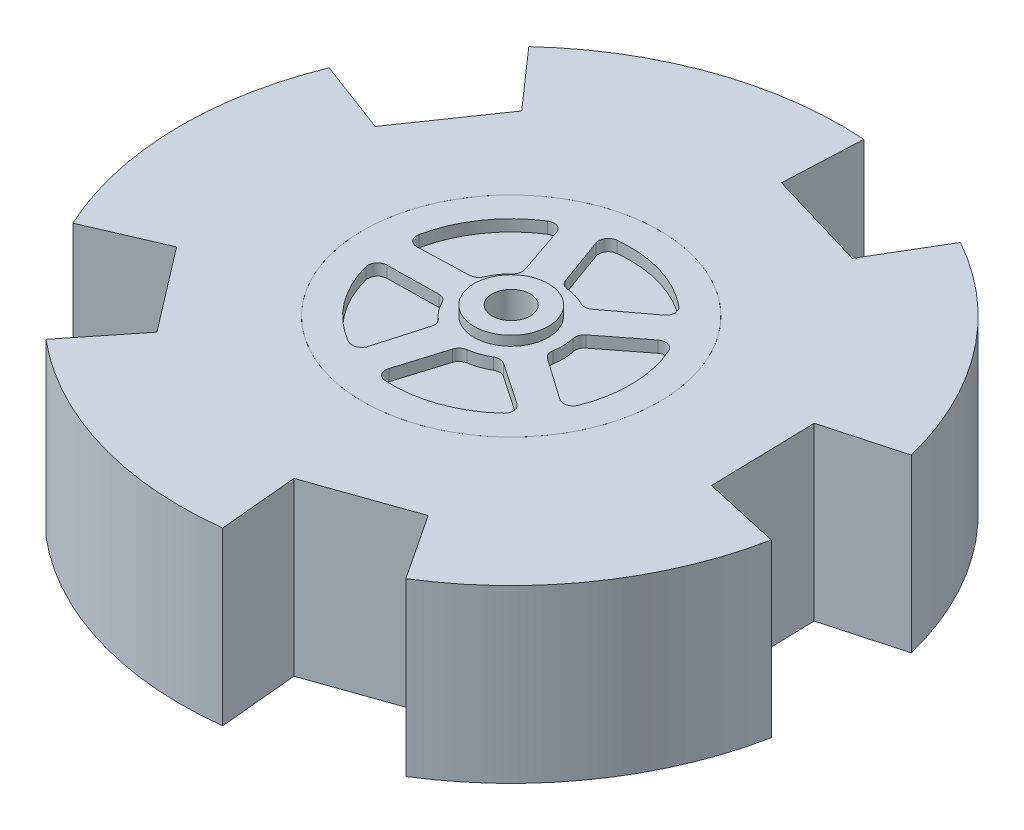
from build123d import *

# Parameters (mm, degrees)
SKETCH1_R                = 34.5
SKETCH1_R_2              = 15.5
BOSS_EXTRUDE1_DEPTH      = 8.95
BOSS_EXTRUDE2_START      = -8.95
SKETCH2_R                = 15.5
BOSS_EXTRUDE2_DEPTH      = 17.9
SKETCH3_R                = 3.875
BOSS_EXTRUDE3_DEPTH      = 1
CUT_EXTRUDE1_START       = 7.75
CUT_EXTRUDE1_DEPTH       = 1.2
FILLET1_R                = 1
CIRPATTERN1_COUNT        = 5
FILLET1_OF_CIRPATTERN1_R = 1
MIRROR1_START            = -8.95
MIRROR1_DEPTH            = 1.2
MIRROR1_START_2          = -9.95
MIRROR1_2_OUTLINE_R      = 3.875
MIRROR1_2_DEPTH          = 1
SKETCH5_R                = 2
CUT_EXTRUDE2_DEPTH       = 53.692599101
CUT_EXTRUDE3_DEPTH       = 53.32313064
CIRPATTERN2_COUNT        = 5


# Read off the part's stored shape, not the designer's step: Cut-Extrude1, Mirror1
with BuildPart() as part:
    # Sketch1 → Boss-Extrude1 (new, symmetric)
    with BuildSketch(Plane(origin=(0, 0, 0), x_dir=(1, 0, 0), z_dir=(0, 1, 0))):
        with Locations(Location((0, 0, 0), (0, 0, 90))):
            Circle(SKETCH1_R)
        with Locations(Location((0, 0, 0), (0, 0, 90))):
            Circle(SKETCH1_R_2, mode=Mode.SUBTRACT)
    extrude(amount=BOSS_EXTRUDE1_DEPTH, both=True)

    # Sketch6 → Cut-Extrude3 (cut, symmetric)
    with BuildSketch(Plane(origin=(0, 8.95, 0), x_dir=(1, 0, 0), z_dir=(0, 1, 0))):
        with BuildLine():
            Line((2.433112603, 34.414095412), (2.064250813, 26.176138082))
            Line((2.064250813, 26.176138082), (12.605799132, 23.03356604))
            Line((12.605799132, 23.03356604), (16.80795122, 30.128769901))
            ThreePointArc((16.80795122, 30.128769901), (9.856248675, 33.062128819), (2.433112603, 34.414095412))
        make_face()
    cut_extrude3 = extrude(amount=CUT_EXTRUDE3_DEPTH, both=True, mode=Mode.SUBTRACT)

    # CirPattern2: Cut-Extrude3 ×5 about axis
    cirpattern2_axis = Axis((0, 0, 0), (0, 1, 0))
    for i in range(1, CIRPATTERN2_COUNT):
        add(cut_extrude3.rotate(cirpattern2_axis, i * 360 / CIRPATTERN2_COUNT), mode=Mode.SUBTRACT)


with BuildPart() as body_2:
    # Sketch2 → Boss-Extrude2 (new body)
    with BuildSketch(Plane(origin=(0, 0, 0), x_dir=(1, 0, 0), z_dir=(0, 1, 0)).offset(BOSS_EXTRUDE2_START)):
        with Locations(Location((0, 0, 0), (0, 0, 270))):
            Circle(SKETCH2_R)
    extrude(amount=BOSS_EXTRUDE2_DEPTH)

    # Sketch3 → Boss-Extrude3 (add)
    with BuildSketch(Plane(origin=(0, 8.95, 0), x_dir=(1, 0, 0), z_dir=(0, 1, 0))):
        with Locations(Location((0, 0, 0), (0, 0, 270))):
            Circle(SKETCH3_R)
    extrude(amount=BOSS_EXTRUDE3_DEPTH)

    # Cut-Extrude1 outline → Cut-Extrude1 (cut)
    with BuildSketch(Plane(origin=(0, 0, 0), x_dir=(1, 0, 0), z_dir=(0, 1, 0)).offset(CUT_EXTRUDE1_START)):
        with BuildLine():
            Line((3.071974537, 4.44105533), (8.842521572, 8.773704599))
            ThreePointArc((8.842521572, 8.773704599), (3.558719439, 11.93748701), (-2.59494852, 12.183362521))
            Line((-2.59494852, 12.183362521), (-0.138760092, 5.398216894))
            ThreePointArc((-0.138760092, 5.398216894), (1.542717184, 5.174941902), (3.071974537, 4.44105533))
        make_face()
    cut_extrude1 = extrude(amount=CUT_EXTRUDE1_DEPTH, mode=Mode.SUBTRACT)

    # Fillet1
    fillet1_edges = [body_2.edges().sort_by_distance(p)[0] for p in [
        (-2.59494852, 8.35, -12.183362521),
        (8.842521572, 8.35, -8.773704599),
        (3.071974537, 8.35, -4.44105533),
        (-0.138760092, 8.35, -5.398216894),
    ]]
    fillet(fillet1_edges, radius=FILLET1_R)

    # CirPattern1: Cut-Extrude1 ×5 about axis
    cirpattern1_axis = Axis((0, 0, 0), (0, 1, 0))
    for i in range(1, CIRPATTERN1_COUNT):
        add(cut_extrude1.rotate(cirpattern1_axis, i * 360 / CIRPATTERN1_COUNT), mode=Mode.SUBTRACT)

    # Fillet1 of CirPattern1
    fillet1_of_cirpattern1_edges = [body_2.edges().sort_by_distance(p)[0] for p in [
        (-12.388949508, 8.35, -1.296923368),
        (-5.611799492, 8.35, -11.120961586),
        (-3.274402273, 8.35, -4.293982971),
        (-5.17688858, 8.35, -1.53617207),
        (-5.061843361, 8.35, 11.381819799),
        (-12.310804396, 8.35, 1.900572351),
        (-5.095666434, 8.35, 1.787227907),
        (-3.060733006, 8.35, 4.448810342),
        (9.260558265, 8.35, 8.331274858),
        (-1.996696054, 8.35, 12.295579897),
        (0.125107221, 8.35, 5.398550563),
        (3.285251552, 8.35, 4.285688071),
        (10.785183124, 8.35, -6.232808767),
        (11.07677837, 8.35, 5.698513937),
        (5.172986949, 8.35, 1.549259831),
        (5.091130127, 8.35, -1.800109449),
    ]]
    fillet(fillet1_of_cirpattern1_edges, radius=FILLET1_OF_CIRPATTERN1_R)

    # Mirror1 outline → Mirror1 (cut)
    with BuildSketch(Plane(origin=(0, 0, 0), x_dir=(1, 0, 0), z_dir=(0, 1, 0)).offset(MIRROR1_START)):
        with BuildLine():
            ThreePointArc((7.912150219, 9.621120468), (3.558719439, 11.93748701), (-1.352433209, 12.383012742))
            ThreePointArc((-1.352433209, 12.383012742), (-2.092524389, 11.917859003), (-2.184150137, 11.048544516))
            Line((-2.184150137, 11.048544516), (-0.368934217, 6.034065893))
            ThreePointArc((-0.368934217, 6.034065893), (-0.03894228, 5.582272129), (0.482079862, 5.378438343))
            ThreePointArc((0.482079862, 5.378438343), (1.542717184, 5.174941902), (2.541647812, 4.764454471))
            ThreePointArc((2.541647812, 4.764454471), (3.089232431, 4.649722745), (3.612743558, 4.847076195))
            Line((3.612743558, 4.847076195), (7.87739554, 8.049067477))
            ThreePointArc((7.87739554, 8.049067477), (8.276731026, 8.826649707), (7.912150219, 9.621120468))
        make_face()
        with BuildLine():
            ThreePointArc((-0.745911268, -12.434295176), (4.137614309, -11.749392664), (8.372693719, -9.223127455))
            ThreePointArc((8.372693719, -9.223127455), (8.698029553, -8.411795494), (8.261186105, -7.654649037))
            Line((8.261186105, -7.654649037), (3.845208994, -4.664807761))
            ThreePointArc((3.845208994, -4.664807761), (3.312682197, -4.493263322), (2.771355937, -4.634607456))
            ThreePointArc((2.771355937, -4.634607456), (1.793670112, -5.093402353), (0.7442398, -5.348467736))
            ThreePointArc((0.7442398, -5.348467736), (0.233796921, -5.577509984), (-0.07373103, -6.044884399))
            Line((-0.07373103, -6.044884399), (-1.641823706, -11.142049303))
            ThreePointArc((-1.641823706, -11.142049303), (-1.507841533, -12.005850051), (-0.745911268, -12.434295176))
        make_face()
        with BuildLine():
            ThreePointArc((11.595218195, -4.551812294), (12.452929594, 0.304343044), (11.359020114, 5.112801795))
            ThreePointArc((11.359020114, 5.112801795), (10.687931868, 5.672929924), (9.832850747, 5.491438239))
            Line((9.832850747, 5.491438239), (5.624730745, 2.215506197))
            ThreePointArc((5.624730745, 2.215506197), (5.297022457, 1.762053264), (5.264169703, 1.203543657))
            ThreePointArc((5.264169703, 1.203543657), (5.398388045, 0.131933762), (5.316677838, -0.944953313))
            ThreePointArc((5.316677838, -0.944953313), (5.376774436, -1.501191286), (5.726242556, -1.938094385))
            Line((5.726242556, -1.938094385), (10.089367167, -5.004549721))
            ThreePointArc((10.089367167, -5.004549721), (10.952293266, -5.144054213), (11.595218195, -4.551812294))
        make_face()
        with BuildLine():
            ThreePointArc((-12.056216711, -3.133004751), (-9.895743318, -7.565867058), (-6.184410819, -10.813008045))
            ThreePointArc((-6.184410819, -10.813008045), (-5.312253969, -10.871705446), (-4.727156947, -10.222271516))
            Line((-4.727156947, -10.222271516), (-3.248260892, -5.098515944))
            ThreePointArc((-3.248260892, -5.098515944), (-3.249672266, -4.539042717), (-3.551377539, -4.067888589))
            ThreePointArc((-3.551377539, -4.067888589), (-4.289838951, -3.279829535), (-4.856712346, -2.360581535))
            ThreePointArc((-4.856712346, -2.360581535), (-5.232279993, -1.945899456), (-5.771810839, -1.797849632))
            Line((-5.771810839, -1.797849632), (-11.104070021, -1.881615453))
            ThreePointArc((-11.104070021, -1.881615453), (-11.884190583, -2.275969182), (-12.056216711, -3.133004751))
        make_face()
        with BuildLine():
            ThreePointArc((-6.705240435, 10.497991753), (-10.253520024, 7.073429668), (-12.194869805, 2.540320962))
            ThreePointArc((-12.194869805, 2.540320962), (-11.981183062, 1.692712013), (-11.182729768, 1.336937798))
            Line((-11.182729768, 1.336937798), (-5.85274463, 1.513751615))
            ThreePointArc((-5.85274463, 1.513751615), (-5.32109011, 1.687980646), (-4.966227963, 2.120514045))
            ThreePointArc((-4.966227963, 2.120514045), (-4.44493639, 3.066356223), (-3.745853103, 3.889548114))
            ThreePointArc((-3.745853103, 3.889548114), (-3.467523795, 4.374877982), (-3.493444245, 4.93375222))
            Line((-3.493444245, 4.93375222), (-5.220868981, 9.979146999))
            ThreePointArc((-5.220868981, 9.979146999), (-5.836992176, 10.599223739), (-6.705240435, 10.497991753))
        make_face()
    extrude(amount=MIRROR1_DEPTH, mode=Mode.SUBTRACT)

    # Mirror1 2 outline → Mirror1 2 (add)
    with BuildSketch(Plane(origin=(0, 0, 0), x_dir=(1, 0, 0), z_dir=(0, 1, 0)).offset(MIRROR1_START_2)):
        Circle(MIRROR1_2_OUTLINE_R)
    extrude(amount=MIRROR1_2_DEPTH)

    # Sketch5 → Cut-Extrude2 (cut, through all)
    with BuildSketch(Plane(origin=(0, 9.95, 0), x_dir=(1, 0, 0), z_dir=(0, 1, 0))):
        with Locations(Location((0, 0, 0), (0, 0, 270))):
            Circle(SKETCH5_R)
    extrude(amount=-CUT_EXTRUDE2_DEPTH, mode=Mode.SUBTRACT)


solid = Compound([part.part, body_2.part])
